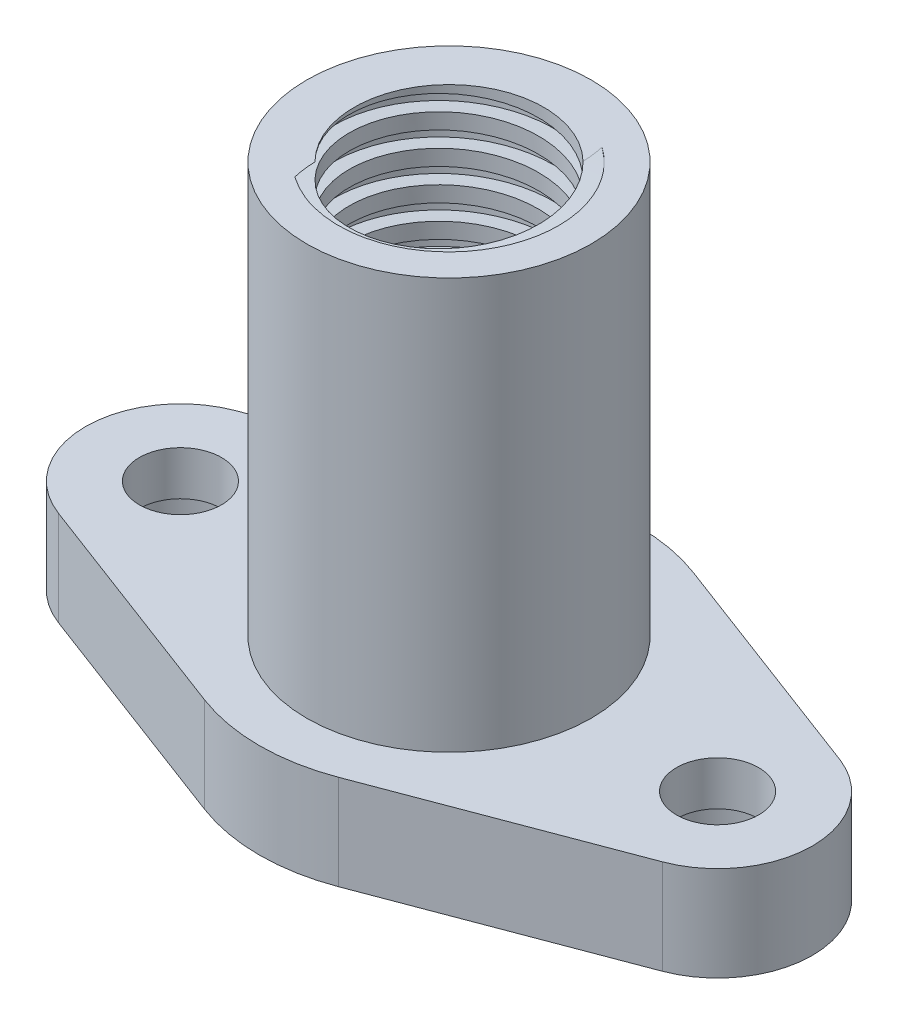
from build123d import *

# Parameters (mm, degrees)
SKETCH1_R           = 15
BOSS_EXTRUDE1_DEPTH = 15
SKETCH2_R           = 6.5
CUT_EXTRUDE1_DEPTH  = 7
SKETCH4_R           = 10
CUT_EXTRUDE2_DEPTH  = 66.3471499
SKETCH5_R           = 22.5
SKETCH5_R_2         = 15
BOSS_EXTRUDE2_DEPTH = 65
CUT_SWEEP1_PITCH    = 5


with BuildPart() as part:
    # Sketch1 → Boss-Extrude1 (new body)
    with BuildSketch(Plane(origin=(0, 0, 0), x_dir=(1, 0, 0), z_dir=(0, 1, 0))):
        with BuildLine():
            Line((-10.588235294, 28.069365389), (-47.794117647, 14.034682695))
            ThreePointArc((-47.794117647, 14.034682695), (-57.5, 0), (-47.794117647, -14.034682695))
            Line((-47.794117647, -14.034682695), (-10.588235294, -28.069365389))
            ThreePointArc((-10.588235294, -28.069365389), (0, -30), (10.588235294, -28.069365389))
            Line((10.588235294, -28.069365389), (47.794117647, -14.034682695))
            ThreePointArc((47.794117647, -14.034682695), (57.5, 0), (47.794117647, 14.034682695))
            Line((47.794117647, 14.034682695), (10.588235294, 28.069365389))
            ThreePointArc((10.588235294, 28.069365389), (0, 30), (-10.588235294, 28.069365389))
        make_face()
        with Locations(Location((0, 0, 0), (0, 0, 270))):
            Circle(SKETCH1_R, mode=Mode.SUBTRACT)
    extrude(amount=BOSS_EXTRUDE1_DEPTH)

    # Sketch2 → Cut-Extrude1 (cut)
    with BuildSketch(Plane(origin=(0, 15, 0), x_dir=(1, 0, 0), z_dir=(0, 1, 0))):
        with Locations(Location((-42.5, 0, 0), (0, 0, 270))):
            Circle(SKETCH2_R)
        with Locations(Location((42.5, 0, 0), (0, 0, 270))):
            Circle(SKETCH2_R)
    extrude(amount=-CUT_EXTRUDE1_DEPTH, mode=Mode.SUBTRACT)

    # Sketch4 → Cut-Extrude2 (cut, through all)
    with BuildSketch(Plane(origin=(0, 8, 0), x_dir=(1, 0, 0), z_dir=(0, 1, 0))):
        with Locations(Location((-42.5, 0, 0), (0, 0, 270))):
            Circle(SKETCH4_R)
        with Locations(Location((42.5, 0, 0), (0, 0, 270))):
            Circle(SKETCH4_R)
    extrude(amount=-CUT_EXTRUDE2_DEPTH, mode=Mode.SUBTRACT)

    # Sketch5 → Boss-Extrude2 (add)
    with BuildSketch(Plane(origin=(0, 15, 0), x_dir=(1, 0, 0), z_dir=(0, 1, 0))):
        with Locations(Location((0, 0, 0), (0, 0, 270))):
            Circle(SKETCH5_R)
        with Locations(Location((0, 0, 0), (0, 0, 270))):
            Circle(SKETCH5_R_2, mode=Mode.SUBTRACT)
    extrude(amount=BOSS_EXTRUDE2_DEPTH)

    # Cut-Sweep1: arcs per turn and ends read off the stored shape
    # Cut-Sweep1: the profile of Sketch7 screwed along a right-hand helix through 22.75 turns, 12 arcs to a turn; built about Z, then put on its axis
    cut_sweep1_z = Axis((0, 0, 0), (0, 0, 1))
    cut_sweep1_corners = [(14.867742594, -0.132257406, -2.507006627), (17.364241738, -0.139264026, -2.374934947), (17.496499145, -0.00700662, -4.86792832), (15, 0, -5)]
    with BuildLine(mode=Mode.PRIVATE) as cut_sweep1_profile:
        Line(cut_sweep1_corners[0], cut_sweep1_corners[1])
        Line(cut_sweep1_corners[1], cut_sweep1_corners[2])
        Line(cut_sweep1_corners[2], cut_sweep1_corners[3])
        Line(cut_sweep1_corners[3], cut_sweep1_corners[0])
    cut_sweep1_cap = Face(cut_sweep1_profile.wire())
    cut_sweep1_turn_angles = [0, 15, 30, 45, 60, 75, 90, 105, 120, 135, 150, 165, 180, 195, 210, 225, 240, 255, 270, 285, 300, 315, 330, 345, 360]
    cut_sweep1_turn_weights = [1, 0.9659258262890683, 1, 0.9659258262890683, 1, 0.9659258262890683, 1, 0.9659258262890683, 1, 0.9659258262890683, 1, 0.9659258262890683, 1, 0.9659258262890683, 1, 0.9659258262890683, 1, 0.9659258262890683, 1, 0.9659258262890683, 1, 0.9659258262890683, 1, 0.9659258262890683, 1]
    cut_sweep1_turn_rails = [Edge.make_bspline([Vector(p[0], p[1], 0).rotate(cut_sweep1_z, cut_sweep1_turn_angles[k]) / cut_sweep1_turn_weights[k] + Vector(0, 0, p[2] + CUT_SWEEP1_PITCH * cut_sweep1_turn_angles[k] / 360) for k in range(25)], [0, 0, 0, 1, 1, 2, 2, 3, 3, 4, 4, 5, 5, 6, 6, 7, 7, 8, 8, 9, 9, 10, 10, 11, 11, 12, 12, 12], 2, cut_sweep1_turn_weights) for p in cut_sweep1_corners]
    cut_sweep1_turn_sides = [Face.make_surface_from_curves(cut_sweep1_turn_rails[p[0]], cut_sweep1_turn_rails[p[1]]) for p in [(0, 1), (1, 2), (2, 3), (3, 0)]]
    cut_sweep1_last_angles = [7920, 7935, 7950, 7965, 7980, 7995, 8010, 8025, 8040, 8055, 8070, 8085, 8100, 8115, 8130, 8145, 8160, 8175, 8190]
    cut_sweep1_last_weights = [1, 0.9659258262890683, 1, 0.9659258262890683, 1, 0.9659258262890683, 1, 0.9659258262890683, 1, 0.9659258262890683, 1, 0.9659258262890683, 1, 0.9659258262890683, 1, 0.9659258262890683, 1, 0.9659258262890683, 1]
    cut_sweep1_last_rails = [Edge.make_bspline([Vector(p[0], p[1], 0).rotate(cut_sweep1_z, cut_sweep1_last_angles[k]) / cut_sweep1_last_weights[k] + Vector(0, 0, p[2] + CUT_SWEEP1_PITCH * cut_sweep1_last_angles[k] / 360) for k in range(19)], [0, 0, 0, 1, 1, 2, 2, 3, 3, 4, 4, 5, 5, 6, 6, 7, 7, 8, 8, 9, 9, 9], 2, cut_sweep1_last_weights) for p in cut_sweep1_corners]
    cut_sweep1_last_sides = [Face.make_surface_from_curves(cut_sweep1_last_rails[p[0]], cut_sweep1_last_rails[p[1]]) for p in [(0, 1), (1, 2), (2, 3), (3, 0)]]
    cut_sweep1 = Plane(origin=(0, 80, 0), x_dir=(-0.7071067811865389, 0, 0.7071067811865561), z_dir=(0, -1, 0)) * Solid(Shell([*[p.moved(Location((0, 0, CUT_SWEEP1_PITCH * i))) for i in range(22) for p in cut_sweep1_turn_sides], *cut_sweep1_last_sides, cut_sweep1_cap, cut_sweep1_cap.rotate(cut_sweep1_z, 8190).moved(Location((0, 0, CUT_SWEEP1_PITCH * 8190 / 360)))]))
    add(cut_sweep1, mode=Mode.SUBTRACT)


solid = part.part
